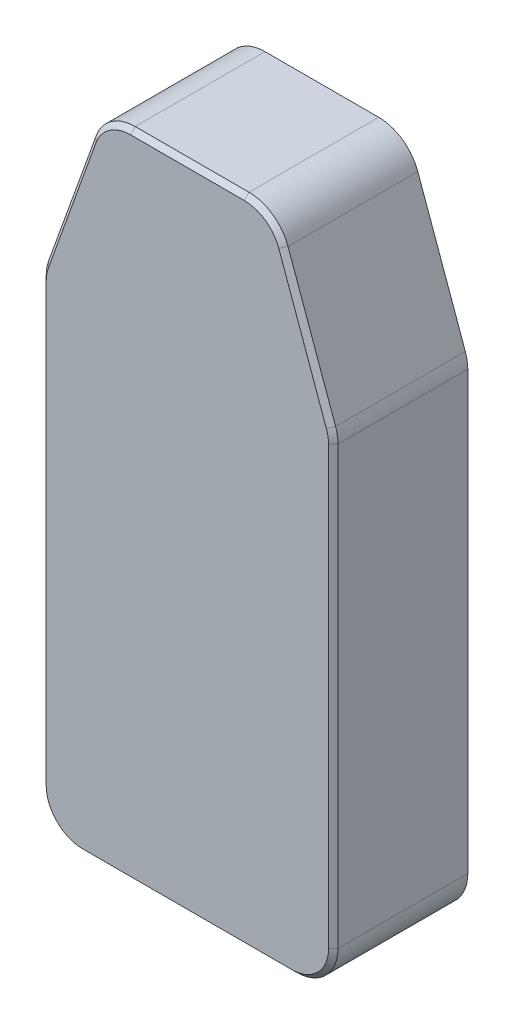
from build123d import *

# Parameters (mm, degrees)
BOSS_EXTRUDE1_DEPTH = 41
BOSS_EXTRUDE2_DEPTH = 1.5
CHAMFER1_SIZE       = 1.5


with BuildPart() as part:
    # Sketch1 → Boss-Extrude1 (new body)
    with BuildSketch(Plane.XY):
        with BuildLine():
            Line((-30.297360891, 123.437225034), (-45.325625095, 81.692046689))
            ThreePointArc((-45.325625095, 81.692046689), (-45.904954257, 79.506966326), (-46.1, 77.254821654))
            Line((-46.1, 77.254821654), (-46.1, -60.733642247))
            ThreePointArc((-46.1, -60.733642247), (-42.263098834, -69.99674108), (-33, -73.833642247))
            Line((-33, -73.833642247), (33, -73.833642247))
            ThreePointArc((33, -73.833642247), (42.263098834, -69.99674108), (46.1, -60.733642247))
            Line((46.1, -60.733642247), (46.1, 77.254821654))
            ThreePointArc((46.1, 77.254821654), (45.904954257, 79.506966326), (45.325625095, 81.692046689))
            Line((45.325625095, 81.692046689), (30.297360891, 123.437225034))
            ThreePointArc((30.297360891, 123.437225034), (25.504409692, 129.717687436), (17.971735796, 132.1))
            Line((17.971735796, 132.1), (-17.971735796, 132.1))
            ThreePointArc((-17.971735796, 132.1), (-25.504409692, 129.717687436), (-30.297360891, 123.437225034))
        make_face()
        with BuildLine():
            Line((-27.474698655, 122.42106663), (-42.50296286, 80.675888284))
            ThreePointArc((-42.50296286, 80.675888284), (-42.949621221, 78.991208005), (-43.1, 77.254821654))
            Line((-43.1, 77.254821654), (-43.1, -60.733642247))
            ThreePointArc((-43.1, -60.733642247), (-40.14177849, -67.875420737), (-33, -70.833642247))
            Line((-33, -70.833642247), (33, -70.833642247))
            ThreePointArc((33, -70.833642247), (40.14177849, -67.875420737), (43.1, -60.733642247))
            Line((43.1, -60.733642247), (43.1, 77.254821654))
            ThreePointArc((43.1, 77.254821654), (42.949621221, 78.991208005), (42.50296286, 80.675888284))
            Line((42.50296286, 80.675888284), (27.474698655, 122.42106663))
            ThreePointArc((27.474698655, 122.42106663), (23.779369868, 127.263255199), (17.971735796, 129.1))
            Line((17.971735796, 129.1), (-17.971735796, 129.1))
            ThreePointArc((-17.971735796, 129.1), (-23.779369868, 127.263255199), (-27.474698655, 122.42106663))
        make_face(mode=Mode.SUBTRACT)
    extrude(amount=BOSS_EXTRUDE1_DEPTH)

    # Sketch2 → Boss-Extrude2 (add)
    with BuildSketch(Plane.XY.offset(41)):
        with BuildLine():
            Line((17.971735796, 132.1), (-17.971735796, 132.1))
            ThreePointArc((-17.971735796, 132.1), (-25.504409692, 129.717687436), (-30.297360891, 123.437225034))
            Line((-30.297360891, 123.437225034), (-45.325625095, 81.692046689))
            ThreePointArc((-45.325625095, 81.692046689), (-45.904954257, 79.506966326), (-46.1, 77.254821654))
            Line((-46.1, 77.254821654), (-46.1, -60.733642247))
            ThreePointArc((-46.1, -60.733642247), (-42.263098834, -69.99674108), (-33, -73.833642247))
            Line((-33, -73.833642247), (33, -73.833642247))
            ThreePointArc((33, -73.833642247), (42.263098834, -69.99674108), (46.1, -60.733642247))
            Line((46.1, -60.733642247), (46.1, 77.254821654))
            ThreePointArc((46.1, 77.254821654), (45.904954257, 79.506966326), (45.325625095, 81.692046689))
            Line((45.325625095, 81.692046689), (30.297360891, 123.437225034))
            ThreePointArc((30.297360891, 123.437225034), (25.504409692, 129.717687436), (17.971735796, 132.1))
        make_face()
    extrude(amount=BOSS_EXTRUDE2_DEPTH)

    # Chamfer1
    chamfer1_edges = [part.edges().sort_by_distance(p)[0] for p in [
        (37.811492993, 102.564635861, 42.5),
        (45.904954257, 79.506966326, 42.5),
        (46.1, 8.260589704, 42.5),
        (42.263098834, -69.99674108, 42.5),
        (0, -73.833642247, 42.5),
        (-42.263098834, -69.99674108, 42.5),
        (-46.1, 8.260589704, 42.5),
        (-45.904954257, 79.506966326, 42.5),
        (-37.811492993, 102.564635861, 42.5),
        (-25.504409692, 129.717687436, 42.5),
        (0, 132.1, 42.5),
        (25.504409692, 129.717687436, 42.5),
        (0, -70.833642247, 0),
        (40.14177849, -67.875420737, 0),
        (-40.14177849, -67.875420737, 0),
        (43.1, 8.260589704, 0),
        (-43.1, 8.260589704, 0),
        (42.949621221, 78.991208005, 0),
        (-42.949621221, 78.991208005, 0),
        (34.988830758, 101.548477457, 0),
        (-34.988830758, 101.548477457, 0),
        (23.779369868, 127.263255199, 0),
        (-23.779369868, 127.263255199, 0),
        (0, 129.1, 0),
    ]]
    chamfer(chamfer1_edges, length=CHAMFER1_SIZE)


solid = part.part
